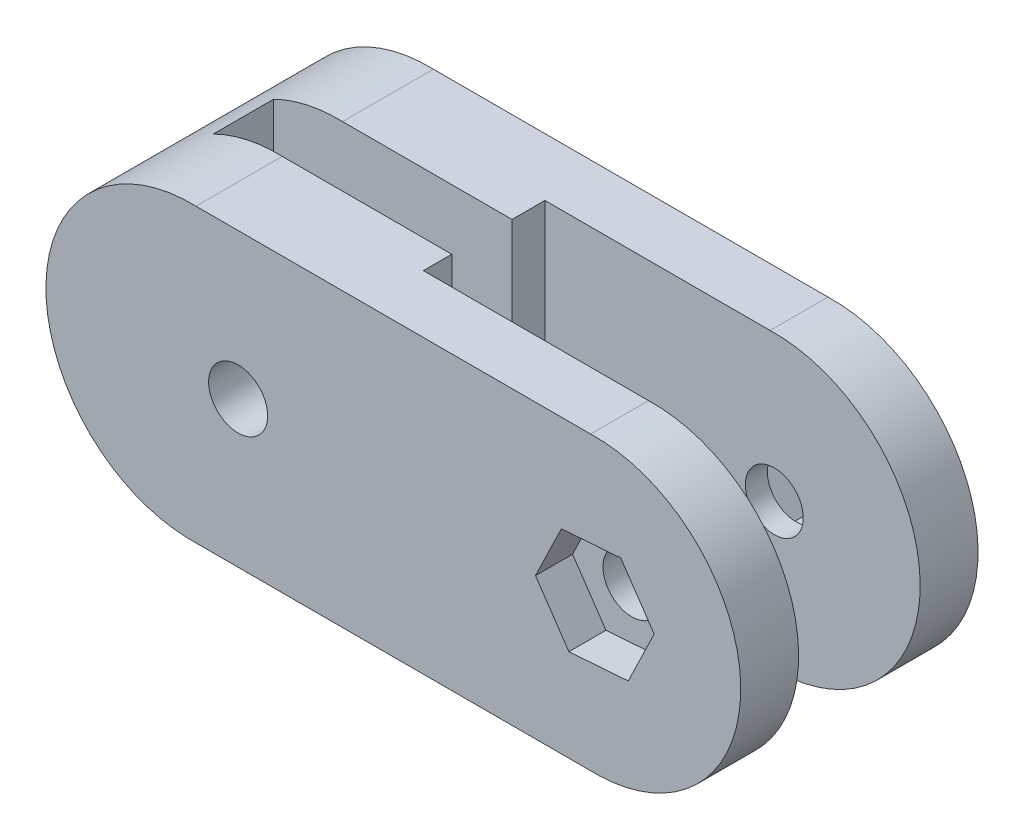
from build123d import *

# Parameters (mm, degrees)
BOSS_EXTRUDE1_DEPTH      = 3.175
BOSS_EXTRUDE1_DEPTH_BACK = 3.175
SKETCH1_R                = 3.238079536
SKETCH3_R                = 3.175
BOSS_EXTRUDE3_DEPTH      = 6.35
SKETCH4_R                = 3.238079536
BOSS_EXTRUDE4_DEPTH      = 13.335
SKETCH6_R                = 3.175
SKETCH6_R_2              = 3.238079536
BOSS_EXTRUDE6_DEPTH      = 6.35
CUT_EXTRUDE1_START       = -4.064
CUT_EXTRUDE1_DEPTH       = 72.586391298
SKETCH10_W               = 6.611687986
SKETCH10_H               = 49.092895062
CUT_EXTRUDE2_DEPTH       = 26.162


with BuildPart() as part:
    # Sketch1 → Boss-Extrude1 (new, two sides: drawn at the far end of the back side and taken through both)
    with BuildSketch(Plane.XY.offset(-BOSS_EXTRUDE1_DEPTH_BACK)):
        with BuildLine():
            Line((0.459472951, 15.995402108), (9.404597892, 15.995402108))
            Line((9.404597892, 15.995402108), (9.404597892, -15.995402108))
            Line((9.404597892, -15.995402108), (-0.459472951, -15.995402108))
            ThreePointArc((-0.459472951, -15.995402108), (-15.995402108, 0.459472951), (0.459472951, 15.995402108))
        make_face()
        with Locations((5.08, 0)):
            Circle(SKETCH1_R, mode=Mode.SUBTRACT)
    extrude(amount=BOSS_EXTRUDE1_DEPTH + BOSS_EXTRUDE1_DEPTH_BACK)

    # Sketch3 → Boss-Extrude3 (add)
    with BuildSketch(Plane.XY.offset(3.175)):
        with BuildLine():
            Line((43.749722832, 15.995402108), (9.404597892, 15.995402108))
            Line((9.404597892, 15.995402108), (9.404597892, -15.995402108))
            Line((9.404597892, -15.995402108), (44.668668734, -15.995402108))
            ThreePointArc((44.668668734, -15.995402108), (60.204597892, 0.459472951), (43.749722832, 15.995402108))
        make_face()
        with Locations((44.209195783, 0)):
            Circle(SKETCH3_R, mode=Mode.SUBTRACT)
    extrude(amount=-BOSS_EXTRUDE3_DEPTH)

    # Sketch4 → Boss-Extrude4 (add)
    with BuildSketch(Plane.XY.offset(3.175)):
        with BuildLine():
            Line((19.05, 15.995402108), (19.05, -15.995402108))
            Line((19.05, -15.995402108), (-0.459472951, -15.995402108))
            ThreePointArc((-0.459472951, -15.995402108), (-15.995402108, 0.459472951), (0.459472951, 15.995402108))
            Line((0.459472951, 15.995402108), (19.05, 15.995402108))
        make_face()
        with Locations((5.08, 0)):
            Circle(SKETCH4_R, mode=Mode.SUBTRACT)
    extrude(amount=BOSS_EXTRUDE4_DEPTH)

    # Sketch6 → Boss-Extrude6 (add)
    with BuildSketch(Plane.XY.offset(16.51)):
        with BuildLine():
            Line((43.749722832, 15.995402108), (0.459472951, 15.995402108))
            ThreePointArc((0.459472951, 15.995402108), (-15.995402108, 0.459472951), (-0.459472951, -15.995402108))
            Line((-0.459472951, -15.995402108), (44.668668734, -15.995402108))
            ThreePointArc((44.668668734, -15.995402108), (60.204597892, 0.459472951), (43.749722832, 15.995402108))
        make_face()
        with Locations((44.209195783, 0)):
            Circle(SKETCH6_R, mode=Mode.SUBTRACT)
        with Locations((5.08, 0)):
            Circle(SKETCH6_R_2, mode=Mode.SUBTRACT)
    extrude(amount=BOSS_EXTRUDE6_DEPTH)

    # Sketch7 → Cut-Extrude1 (cut)
    with BuildSketch(Plane.XY.offset(22.86).offset(CUT_EXTRUDE1_START)):
        Polygon((50.717726322, 0.474306404), (47.052699657, 5.87370599), (40.544169119, 5.399399585), (37.700665245, -0.474306404), (41.365691909, -5.87370599), (47.874222448, -5.399399585), align=None)
    cut_extrude1 = extrude(amount=CUT_EXTRUDE1_DEPTH, mode=Mode.SUBTRACT)

    # Mirror3: Cut-Extrude1 across plane
    add(cut_extrude1.mirror(Plane.XY.offset(9.779)), mode=Mode.SUBTRACT)

    # Sketch10 → Cut-Extrude2 (cut)
    with BuildSketch(Plane(origin=(19.05, 0, 0), x_dir=(0, 0, -1), z_dir=(1, 0, 0))):
        with Locations((-10.090252047, 0)):
            Rectangle(SKETCH10_W, SKETCH10_H)
    extrude(amount=-CUT_EXTRUDE2_DEPTH, mode=Mode.SUBTRACT)


solid = part.part
